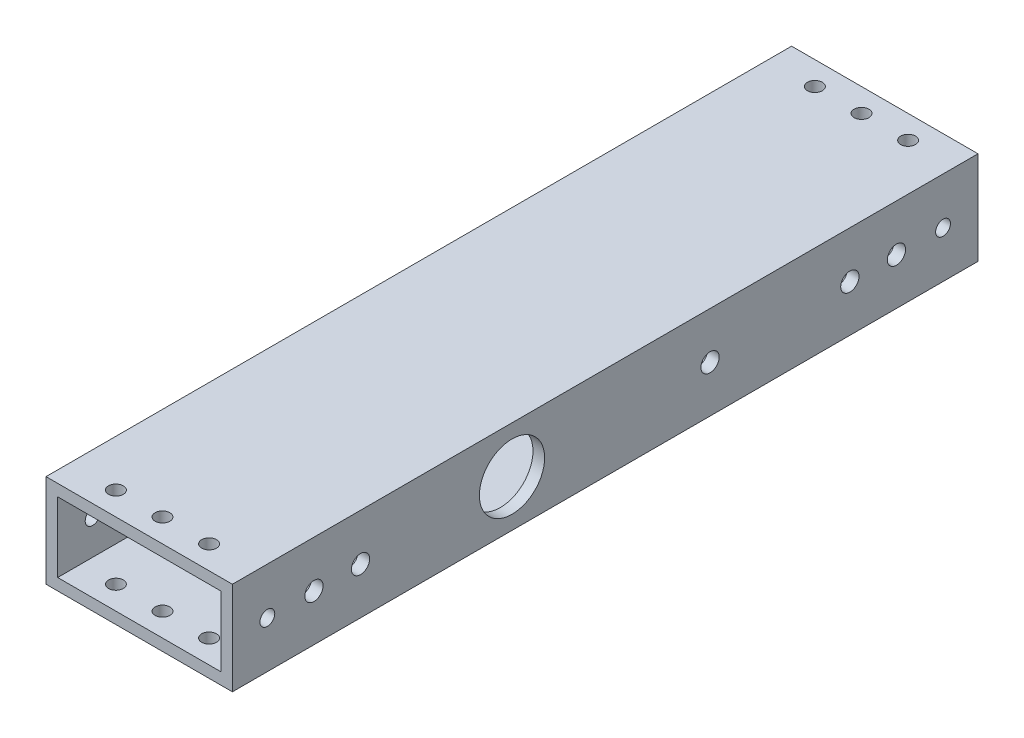
from build123d import *

# Parameters (mm, degrees)
SKETCH1_W           = 50.8
SKETCH1_H           = 25.4
SKETCH1_W_2         = 44.45
SKETCH1_H_2         = 19.05
BOSS_EXTRUDE1_DEPTH = 101.6
SKETCH2_R           = 2.0193
SKETCH2_R_2         = 2.4892
CUT_EXTRUDE1_DEPTH  = 115.3
SKETCH3_R           = 2.0193
CUT_EXTRUDE2_DEPTH  = 108.763073453
SKETCH4_R           = 8.89
SKETCH4_R_2         = 2.4892
CUT_EXTRUDE3_DEPTH  = 115.3
CUT_EXTRUDE4_REACH  = 109.763
SKETCH5_R           = 2.5527


with BuildPart() as part:
    # Sketch1 → Boss-Extrude1 (new, symmetric)
    with BuildSketch(Plane.XY):
        Rectangle(SKETCH1_W, SKETCH1_H)
        Rectangle(SKETCH1_W_2, SKETCH1_H_2, mode=Mode.SUBTRACT)
    extrude(amount=BOSS_EXTRUDE1_DEPTH, both=True)

    # Sketch2 → Cut-Extrude1 (cut, through all)
    with BuildSketch(Plane(origin=(25.4, 0, 0), x_dir=(0, 0, -1), z_dir=(1, 0, 0))):
        with Locations((-92.075, 0)):
            Circle(SKETCH2_R)
        with Locations((92.075, 0)):
            Circle(SKETCH2_R)
        with Locations((-79.375, 0)):
            Circle(SKETCH2_R_2)
        with Locations((-66.675, 0)):
            Circle(SKETCH2_R_2)
        with Locations((66.675, 0)):
            Circle(SKETCH2_R_2)
        with Locations((79.375, 0)):
            Circle(SKETCH2_R_2)
    extrude(amount=-CUT_EXTRUDE1_DEPTH, mode=Mode.SUBTRACT)

    # Sketch3 → Cut-Extrude2 (cut, through all)
    with BuildSketch(Plane(origin=(0, 12.7, 0), x_dir=(1, 0, 0), z_dir=(0, 1, 0))):
        with Locations((-12.7, -95.25)):
            Circle(SKETCH3_R)
        with Locations((0, -95.25)):
            Circle(SKETCH3_R)
        with Locations((12.7, -95.25)):
            Circle(SKETCH3_R)
        with Locations((12.7, 95.25)):
            Circle(SKETCH3_R)
        with Locations((0, 95.25)):
            Circle(SKETCH3_R)
        with Locations((-12.7, 95.25)):
            Circle(SKETCH3_R)
    extrude(amount=-CUT_EXTRUDE2_DEPTH, mode=Mode.SUBTRACT)

    # Sketch4 → Cut-Extrude3 (cut, through all)
    with BuildSketch(Plane(origin=(25.4, 0, 0), x_dir=(0, 0, -1), z_dir=(1, 0, 0))):
        with Locations((-25.4, 0)):
            Circle(SKETCH4_R)
        with Locations((-66.675, 0)):
            Circle(SKETCH4_R_2)
        with Locations((28.575, 0)):
            Circle(SKETCH4_R_2)
    extrude(amount=-CUT_EXTRUDE3_DEPTH, mode=Mode.SUBTRACT)

    # Sketch5 → Cut-Extrude4 (cut, up to next)
    with BuildSketch(Plane.XZ.offset(12.7), mode=Mode.PRIVATE) as cut_extrude4_sk1:
        with Locations((-3.81, 63.5)):
            Circle(SKETCH5_R)
    cut_extrude4_tool1 = extrude(cut_extrude4_sk1.sketch, amount=-CUT_EXTRUDE4_REACH, mode=Mode.PRIVATE) & part.part
    # Sketch5 → Cut-Extrude4 (cut, up to next)
    with BuildSketch(Plane.XZ.offset(12.7), mode=Mode.PRIVATE) as cut_extrude4_sk2:
        with Locations((-16.51, 63.5)):
            Circle(SKETCH5_R)
    cut_extrude4_tool2 = extrude(cut_extrude4_sk2.sketch, amount=-CUT_EXTRUDE4_REACH, mode=Mode.PRIVATE) & part.part
    # Sketch5 → Cut-Extrude4 (cut, up to next)
    with BuildSketch(Plane.XZ.offset(12.7), mode=Mode.PRIVATE) as cut_extrude4_sk3:
        with Locations((-16.51, 50.8)):
            Circle(SKETCH5_R)
    cut_extrude4_tool3 = extrude(cut_extrude4_sk3.sketch, amount=-CUT_EXTRUDE4_REACH, mode=Mode.PRIVATE) & part.part
    # Sketch5 → Cut-Extrude4 (cut, up to next)
    with BuildSketch(Plane.XZ.offset(12.7), mode=Mode.PRIVATE) as cut_extrude4_sk4:
        with Locations((-3.81, 50.8)):
            Circle(SKETCH5_R)
    cut_extrude4_tool4 = extrude(cut_extrude4_sk4.sketch, amount=-CUT_EXTRUDE4_REACH, mode=Mode.PRIVATE) & part.part
    # Sketch5 → Cut-Extrude4 (cut, up to next)
    with BuildSketch(Plane.XZ.offset(12.7), mode=Mode.PRIVATE) as cut_extrude4_sk5:
        with Locations((-16.51, -12.7)):
            Circle(SKETCH5_R)
    cut_extrude4_tool5 = extrude(cut_extrude4_sk5.sketch, amount=-CUT_EXTRUDE4_REACH, mode=Mode.PRIVATE) & part.part
    # Sketch5 → Cut-Extrude4 (cut, up to next)
    with BuildSketch(Plane.XZ.offset(12.7), mode=Mode.PRIVATE) as cut_extrude4_sk6:
        with Locations((-3.81, -12.7)):
            Circle(SKETCH5_R)
    cut_extrude4_tool6 = extrude(cut_extrude4_sk6.sketch, amount=-CUT_EXTRUDE4_REACH, mode=Mode.PRIVATE) & part.part
    # Sketch5 → Cut-Extrude4 (cut, up to next)
    with BuildSketch(Plane.XZ.offset(12.7), mode=Mode.PRIVATE) as cut_extrude4_sk7:
        with Locations((-3.81, 0)):
            Circle(SKETCH5_R)
    cut_extrude4_tool7 = extrude(cut_extrude4_sk7.sketch, amount=-CUT_EXTRUDE4_REACH, mode=Mode.PRIVATE) & part.part
    # Sketch5 → Cut-Extrude4 (cut, up to next)
    with BuildSketch(Plane.XZ.offset(12.7), mode=Mode.PRIVATE) as cut_extrude4_sk8:
        with Locations((-16.51, 0)):
            Circle(SKETCH5_R)
    cut_extrude4_tool8 = extrude(cut_extrude4_sk8.sketch, amount=-CUT_EXTRUDE4_REACH, mode=Mode.PRIVATE) & part.part
    add(cut_extrude4_tool1.solids().sort_by_distance((-3.81, -12.7, 63.5))[0], mode=Mode.SUBTRACT)
    add(cut_extrude4_tool2.solids().sort_by_distance((-16.51, -12.7, 63.5))[0], mode=Mode.SUBTRACT)
    add(cut_extrude4_tool3.solids().sort_by_distance((-16.51, -12.7, 50.8))[0], mode=Mode.SUBTRACT)
    add(cut_extrude4_tool4.solids().sort_by_distance((-3.81, -12.7, 50.8))[0], mode=Mode.SUBTRACT)
    add(cut_extrude4_tool5.solids().sort_by_distance((-16.51, -12.7, -12.7))[0], mode=Mode.SUBTRACT)
    add(cut_extrude4_tool6.solids().sort_by_distance((-3.81, -12.7, -12.7))[0], mode=Mode.SUBTRACT)
    add(cut_extrude4_tool7.solids().sort_by_distance((-3.81, -12.7, 0))[0], mode=Mode.SUBTRACT)
    add(cut_extrude4_tool8.solids().sort_by_distance((-16.51, -12.7, 0))[0], mode=Mode.SUBTRACT)


solid = part.part
